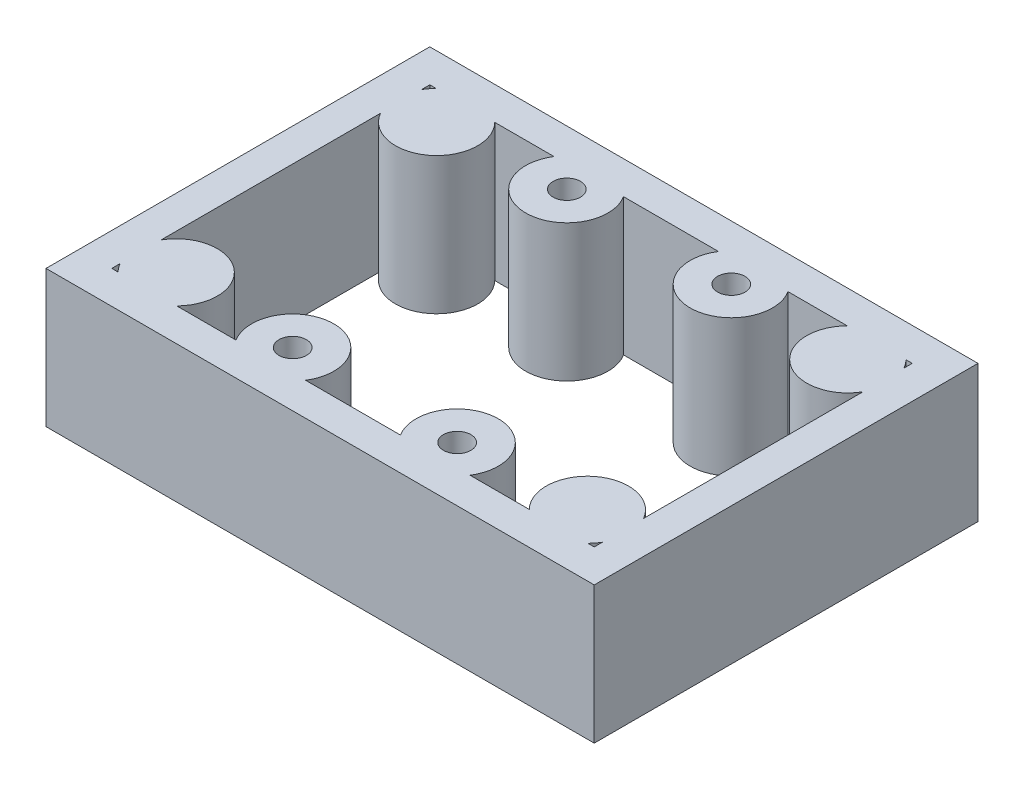
from build123d import *

# Parameters (mm, degrees)
BOSS_EXTRUDE1_START  = 46
SKETCH1_W            = 40
SKETCH1_H            = 10
BOSS_EXTRUDE1_DEPTH  = 28
BOSS_EXTRUDE2_START  = 48.4
SKETCH2_W            = 35.2
SKETCH2_H            = 12
BOSS_EXTRUDE2_DEPTH  = 23.2
BOSS_EXTRUDE3_START  = 50
SKETCH3_R            = 3
BOSS_EXTRUDE3_DEPTH  = 10
BOSS_EXTRUDE4_START  = 50
SKETCH4_R            = 3
BOSS_EXTRUDE4_DEPTH  = 10
BOSS_EXTRUDE5_START  = 50
SKETCH5_R            = 3
BOSS_EXTRUDE5_DEPTH  = 10
BOSS_EXTRUDE6_START  = 50
SKETCH6_R            = 3
BOSS_EXTRUDE6_DEPTH  = 10
BOSS_EXTRUDE7_START  = 50
SKETCH7_R            = 3
BOSS_EXTRUDE7_DEPTH  = 10
BOSS_EXTRUDE8_START  = 50
SKETCH8_R            = 3
BOSS_EXTRUDE8_DEPTH  = 10
BOSS_EXTRUDE9_START  = 50
SKETCH9_R            = 3
BOSS_EXTRUDE9_DEPTH  = 10
BOSS_EXTRUDE10_START = 50
SKETCH10_R           = 3
BOSS_EXTRUDE10_DEPTH = 10
BOSS_EXTRUDE11_START = 49
SKETCH11_R           = 1
BOSS_EXTRUDE11_DEPTH = 9.5
BOSS_EXTRUDE12_START = 49
SKETCH12_R           = 1
BOSS_EXTRUDE12_DEPTH = 9.5
BOSS_EXTRUDE13_START = 49
SKETCH13_R           = 1
BOSS_EXTRUDE13_DEPTH = 9.5
BOSS_EXTRUDE14_START = 49
SKETCH14_R           = 1
BOSS_EXTRUDE14_DEPTH = 9.5
BOSS_EXTRUDE15_START = 51.5
SKETCH15_R           = 1
BOSS_EXTRUDE15_DEPTH = 9.5
BOSS_EXTRUDE16_START = 51.5
SKETCH16_R           = 1
BOSS_EXTRUDE16_DEPTH = 9.5
BOSS_EXTRUDE17_START = 51.5
SKETCH17_R           = 1
BOSS_EXTRUDE17_DEPTH = 9.5
BOSS_EXTRUDE18_START = 51.5
SKETCH18_R           = 1
BOSS_EXTRUDE18_DEPTH = 9.5


with BuildPart() as part:
    # Sketch1 → Boss-Extrude1 (new body)
    with BuildSketch(Plane.XY.offset(BOSS_EXTRUDE1_START)):
        with Locations((0, 55)):
            Rectangle(SKETCH1_W, SKETCH1_H)
    extrude(amount=BOSS_EXTRUDE1_DEPTH)


with BuildPart() as body_2:
    # Sketch2 → Boss-Extrude2 (new body)
    with BuildSketch(Plane.XY.offset(BOSS_EXTRUDE2_START)):
        with Locations((0, 55)):
            Rectangle(SKETCH2_W, SKETCH2_H)
    extrude(amount=BOSS_EXTRUDE2_DEPTH)


with BuildPart() as part_1:
    add(part.part)

    # Combine1: cut body 2
    add(body_2.part, mode=Mode.SUBTRACT)

    # Sketch3 → Boss-Extrude3 (add)
    with BuildSketch(Plane(origin=(0, 0, 0), x_dir=(1, 0, 0), z_dir=(0, 1, 0)).offset(BOSS_EXTRUDE3_START)):
        with Locations((-15, -50.5)):
            Circle(SKETCH3_R)
    extrude(amount=BOSS_EXTRUDE3_DEPTH)

    # Sketch4 → Boss-Extrude4 (add)
    with BuildSketch(Plane(origin=(0, 0, 0), x_dir=(1, 0, 0), z_dir=(0, 1, 0)).offset(BOSS_EXTRUDE4_START)):
        with Locations((-15, -69.5)):
            Circle(SKETCH4_R)
    extrude(amount=BOSS_EXTRUDE4_DEPTH)

    # Sketch5 → Boss-Extrude5 (add)
    with BuildSketch(Plane(origin=(0, 0, 0), x_dir=(1, 0, 0), z_dir=(0, 1, 0)).offset(BOSS_EXTRUDE5_START)):
        with Locations((15, -50.5)):
            Circle(SKETCH5_R)
    extrude(amount=BOSS_EXTRUDE5_DEPTH)

    # Sketch6 → Boss-Extrude6 (add)
    with BuildSketch(Plane(origin=(0, 0, 0), x_dir=(1, 0, 0), z_dir=(0, 1, 0)).offset(BOSS_EXTRUDE6_START)):
        with Locations((15, -69.5)):
            Circle(SKETCH6_R)
    extrude(amount=BOSS_EXTRUDE6_DEPTH)

    # Sketch7 → Boss-Extrude7 (add)
    with BuildSketch(Plane(origin=(0, 0, 0), x_dir=(1, 0, 0), z_dir=(0, 1, 0)).offset(BOSS_EXTRUDE7_START)):
        with Locations((-6, -50)):
            Circle(SKETCH7_R)
    extrude(amount=BOSS_EXTRUDE7_DEPTH)

    # Sketch8 → Boss-Extrude8 (add)
    with BuildSketch(Plane(origin=(0, 0, 0), x_dir=(1, 0, 0), z_dir=(0, 1, 0)).offset(BOSS_EXTRUDE8_START)):
        with Locations((-6, -70)):
            Circle(SKETCH8_R)
    extrude(amount=BOSS_EXTRUDE8_DEPTH)

    # Sketch9 → Boss-Extrude9 (add)
    with BuildSketch(Plane(origin=(0, 0, 0), x_dir=(1, 0, 0), z_dir=(0, 1, 0)).offset(BOSS_EXTRUDE9_START)):
        with Locations((6, -50)):
            Circle(SKETCH9_R)
    extrude(amount=BOSS_EXTRUDE9_DEPTH)

    # Sketch10 → Boss-Extrude10 (add)
    with BuildSketch(Plane(origin=(0, 0, 0), x_dir=(1, 0, 0), z_dir=(0, 1, 0)).offset(BOSS_EXTRUDE10_START)):
        with Locations((6, -70)):
            Circle(SKETCH10_R)
    extrude(amount=BOSS_EXTRUDE10_DEPTH)


with BuildPart() as body_2_2:
    # Sketch11 → Boss-Extrude11 (new body)
    with BuildSketch(Plane(origin=(0, 0, 0), x_dir=(1, 0, 0), z_dir=(0, 1, 0)).offset(BOSS_EXTRUDE11_START)):
        with Locations((-15, -50.5)):
            Circle(SKETCH11_R)
    extrude(amount=BOSS_EXTRUDE11_DEPTH)


with BuildPart() as part_2:
    add(part_1.part)

    # Combine2: cut body 2 2
    add(body_2_2.part, mode=Mode.SUBTRACT)


with BuildPart() as body_2_3:
    # Sketch12 → Boss-Extrude12 (new body)
    with BuildSketch(Plane(origin=(0, 0, 0), x_dir=(1, 0, 0), z_dir=(0, 1, 0)).offset(BOSS_EXTRUDE12_START)):
        with Locations((-15, -69.5)):
            Circle(SKETCH12_R)
    extrude(amount=BOSS_EXTRUDE12_DEPTH)


with BuildPart() as part_3:
    add(part_2.part)

    # Combine3: cut body 2 3
    add(body_2_3.part, mode=Mode.SUBTRACT)


with BuildPart() as body_2_4:
    # Sketch13 → Boss-Extrude13 (new body)
    with BuildSketch(Plane(origin=(0, 0, 0), x_dir=(1, 0, 0), z_dir=(0, 1, 0)).offset(BOSS_EXTRUDE13_START)):
        with Locations((15, -50.5)):
            Circle(SKETCH13_R)
    extrude(amount=BOSS_EXTRUDE13_DEPTH)


with BuildPart() as part_4:
    add(part_3.part)

    # Combine4: cut body 2 4
    add(body_2_4.part, mode=Mode.SUBTRACT)


with BuildPart() as body_2_5:
    # Sketch14 → Boss-Extrude14 (new body)
    with BuildSketch(Plane(origin=(0, 0, 0), x_dir=(1, 0, 0), z_dir=(0, 1, 0)).offset(BOSS_EXTRUDE14_START)):
        with Locations((15, -69.5)):
            Circle(SKETCH14_R)
    extrude(amount=BOSS_EXTRUDE14_DEPTH)


with BuildPart() as part_5:
    add(part_4.part)

    # Combine5: cut body 2 5
    add(body_2_5.part, mode=Mode.SUBTRACT)


with BuildPart() as body_2_6:
    # Sketch15 → Boss-Extrude15 (new body)
    with BuildSketch(Plane(origin=(0, 0, 0), x_dir=(1, 0, 0), z_dir=(0, 1, 0)).offset(BOSS_EXTRUDE15_START)):
        with Locations((-6, -50)):
            Circle(SKETCH15_R)
    extrude(amount=BOSS_EXTRUDE15_DEPTH)


with BuildPart() as part_6:
    add(part_5.part)

    # Combine6: cut body 2 6
    add(body_2_6.part, mode=Mode.SUBTRACT)


with BuildPart() as body_2_7:
    # Sketch16 → Boss-Extrude16 (new body)
    with BuildSketch(Plane(origin=(0, 0, 0), x_dir=(1, 0, 0), z_dir=(0, 1, 0)).offset(BOSS_EXTRUDE16_START)):
        with Locations((-6, -70)):
            Circle(SKETCH16_R)
    extrude(amount=BOSS_EXTRUDE16_DEPTH)


with BuildPart() as part_7:
    add(part_6.part)

    # Combine7: cut body 2 7
    add(body_2_7.part, mode=Mode.SUBTRACT)


with BuildPart() as body_2_8:
    # Sketch17 → Boss-Extrude17 (new body)
    with BuildSketch(Plane(origin=(0, 0, 0), x_dir=(1, 0, 0), z_dir=(0, 1, 0)).offset(BOSS_EXTRUDE17_START)):
        with Locations((6, -50)):
            Circle(SKETCH17_R)
    extrude(amount=BOSS_EXTRUDE17_DEPTH)


with BuildPart() as part_8:
    add(part_7.part)

    # Combine8: cut body 2 8
    add(body_2_8.part, mode=Mode.SUBTRACT)


with BuildPart() as body_2_9:
    # Sketch18 → Boss-Extrude18 (new body)
    with BuildSketch(Plane(origin=(0, 0, 0), x_dir=(1, 0, 0), z_dir=(0, 1, 0)).offset(BOSS_EXTRUDE18_START)):
        with Locations((6, -70)):
            Circle(SKETCH18_R)
    extrude(amount=BOSS_EXTRUDE18_DEPTH)


with BuildPart() as part_9:
    add(part_8.part)

    # Combine9: cut body 2 9
    add(body_2_9.part, mode=Mode.SUBTRACT)


solid = part_9.part
